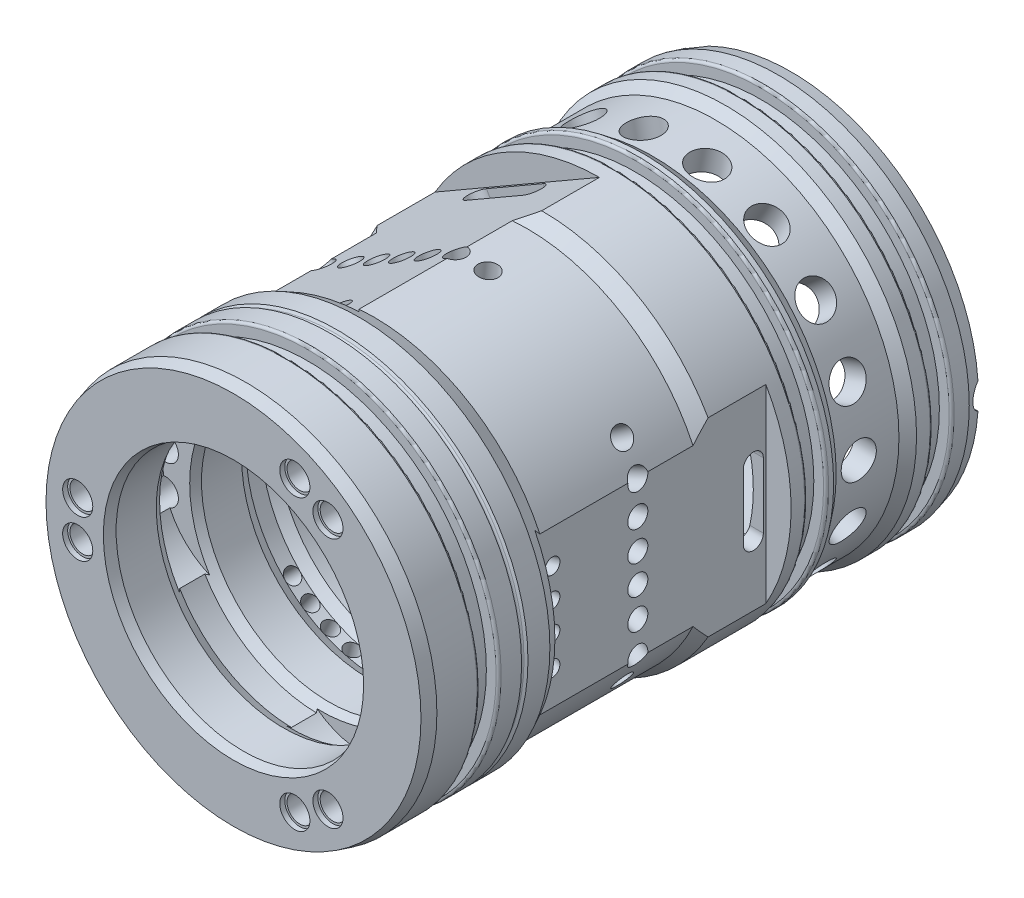
from build123d import *

# Parameters (mm, degrees)
SKETCH2_R          = 3.5
CUT_EXTRUDE1_DEPTH = 124.342390273
CIRPATTERN1_COUNT  = 18
SKETCH3_R          = 3
CUT_EXTRUDE2_DEPTH = 124.342390273
SKETCH4_W          = 10
SKETCH4_H          = 46
CUT_EXTRUDE3_DEPTH = 124.342390363
CIRPATTERN3_COUNT  = 4
CIRPATTERN3_ANGLE  = 30
CIRPATTERN5_COUNT  = 8
CIRPATTERN5_ANGLE  = 70
CUT_EXTRUDE4_DEPTH = 124.342390363
CIRPATTERN2_COUNT  = 3
SKETCH17_R         = 15
CUT_EXTRUDE5_DEPTH = 2.5
SKETCH19_R         = 15
CUT_EXTRUDE6_DEPTH = 3
CIRPATTERN6_COUNT  = 3


# Read off the part's stored shape, not the designer's step: AdvancedHole2
with BuildPart() as part:
    # Sketch1 → Revolve2 (revolve)
    with BuildSketch(Plane(origin=(0, 0, 0), x_dir=(0, 0, -1), z_dir=(1, 0, 0)), mode=Mode.PRIVATE) as revolve2_sk:
        with BuildLine():
            Line((0, 25.910898385), (0, 37.330127019))
            Line((0, 37.330127019), (2.5, 38))
            Line((2.5, 38), (10.5, 38))
            ThreePointArc((10.5, 38), (10.853553391, 37.853553391), (11, 37.5))
            Line((11, 37.5), (11, 35.55))
            Line((11, 35.55), (14.8, 35.55))
            Line((14.8, 35.55), (14.8, 37.5))
            ThreePointArc((14.8, 37.5), (14.946446609, 37.853553391), (15.3, 38))
            Line((15.3, 38), (19.364914704, 38))
            Line((19.364914704, 38), (19.653589838, 37.5))
            ThreePointArc((19.653589838, 37.5), (20, 37.3), (20.346410162, 37.5))
            Line((20.346410162, 37.5), (20.635085296, 38))
            Line((20.635085296, 38), (25, 38))
            Line((25, 38), (28, 36.5))
            Line((28, 36.5), (58.5, 36.5))
            Line((58.5, 36.5), (61.5, 38.028576348))
            Line((61.5, 38.028576348), (75.7, 38.028576348))
            ThreePointArc((75.7, 38.028576348), (76.053553391, 37.882129739), (76.2, 37.528576348))
            Line((76.2, 37.528576348), (76.2, 35.55))
            Line((76.2, 35.55), (80, 35.55))
            Line((80, 35.55), (80, 37.5))
            ThreePointArc((80, 37.5), (80.146446609, 37.853553391), (80.5, 38))
            Line((80.5, 38), (81.5, 38))
            Line((81.5, 38), (83.5, 36.5))
            Line((83.5, 36.5), (96, 36.5))
            Line((96, 36.5), (98, 38.0071081))
            Line((98, 38.0071081), (100.7, 38.0071081))
            ThreePointArc((100.7, 38.0071081), (101.053553391, 37.860661491), (101.2, 37.5071081))
            Line((101.2, 37.5071081), (101.2, 35.55))
            Line((101.2, 35.55), (105, 35.55))
            Line((105, 35.55), (105, 37.5))
            ThreePointArc((105, 37.5), (105.146446609, 37.853553391), (105.5, 38))
            Line((105.5, 38), (108.5, 38))
            Line((108.5, 38), (111, 37.330127019))
            Line((111, 37.330127019), (111, 31.669872981))
            Line((111, 31.669872981), (108.5, 31))
            Line((108.5, 31), (94, 31))
            Line((94, 31), (92, 32))
            Line((92, 32), (84, 32))
            Line((84, 32), (82, 31))
            Line((82, 31), (69, 31))
            Line((69, 31), (68.052094453, 31.167141323))
            ThreePointArc((68.052094453, 31.167141323), (67.701141591, 30.89784572), (68, 30.571698997))
            Line((68, 30.571698997), (68, 28.3))
            ThreePointArc((68, 28.3), (67.912132034, 28.087867966), (67.7, 28))
            Line((67.7, 28), (66.3, 28))
            Line((66.3, 28), (65.552287573, 28.131841875))
            ThreePointArc((65.552287573, 28.131841875), (65.201343141, 27.862642463), (65.5, 27.536399611))
            Line((65.5, 27.536399611), (65.5, 26.43))
            ThreePointArc((65.5, 26.43), (65.412132034, 26.217867966), (65.2, 26.13))
            Line((65.2, 26.13), (59, 26.13))
            Line((59, 26.13), (58, 27))
            Line((58, 27), (54, 27))
            Line((54, 27), (54, 25.68))
            ThreePointArc((54, 25.68), (53.912132034, 25.467867966), (53.7, 25.38))
            Line((53.7, 25.38), (49.8, 25.38))
            ThreePointArc((49.8, 25.38), (49.587867966, 25.467867966), (49.5, 25.68))
            Line((49.5, 25.68), (49.5, 27))
            Line((49.5, 27), (45, 27))
            Line((45, 27), (45, 25.68))
            ThreePointArc((45, 25.68), (44.912132034, 25.467867966), (44.7, 25.38))
            Line((44.7, 25.38), (34, 25.38))
            Line((34, 25.38), (32, 26.5))
            Line((32, 26.5), (29, 26.5))
            Line((29, 26.5), (27, 25.375))
            Line((27, 25.375), (19, 25.375))
            Line((19, 25.375), (17, 26.5))
            Line((17, 26.5), (12, 26.5))
            Line((12, 26.5), (10, 25.375))
            Line((10, 25.375), (2, 25.375))
            Line((2, 25.375), (0, 25.910898385))
        make_face()
    revolve(revolve2_sk.sketch.rotate(Axis((0, 0, 0), (0, 0, -1)), 90), axis=Axis((0, 0, 0), (0, 0, -1)))

    # Sketch2 → Cut-Extrude1 (cut, through all)
    with BuildSketch(Plane(origin=(0, 0, 0), x_dir=(0, 0, -1), z_dir=(1, 0, 0))):
        with Locations(Location((88, 0, 0), (0, 0, 180))):
            Circle(SKETCH2_R)
    cut_extrude1 = extrude(amount=CUT_EXTRUDE1_DEPTH, mode=Mode.SUBTRACT)

    # CirPattern1: Cut-Extrude1 ×18 about axis
    cirpattern1_axis = Axis((0, 0, 0), (0, 0, 1))
    for i in range(1, CIRPATTERN1_COUNT):
        add(cut_extrude1.rotate(cirpattern1_axis, i * 360 / CIRPATTERN1_COUNT), mode=Mode.SUBTRACT)

    # Sketch3 → Cut-Extrude2 (cut, through all)
    with BuildSketch(Plane(origin=(0, 0, 0), x_dir=(0, 0, -1), z_dir=(1, 0, 0))):
        with Locations((112.5, 0)):
            Circle(SKETCH3_R)
    cut_extrude2 = extrude(amount=CUT_EXTRUDE2_DEPTH, mode=Mode.SUBTRACT)

    # Sketch4 → Cut-Extrude3 (cut, symmetric)
    with BuildSketch(Plane(origin=(0, 0, 0), x_dir=(1, 0, 0), z_dir=(0, 1, 0))):
        with Locations((38, 50)):
            Rectangle(SKETCH4_W, SKETCH4_H)
    cut_extrude3 = extrude(amount=CUT_EXTRUDE3_DEPTH, both=True, mode=Mode.SUBTRACT)

    # Sketch5 → Cut-Revolve1 (revolve, cut)
    with BuildSketch(Plane(origin=(0, 0, -30.5), x_dir=(-1, 0, 0), z_dir=(0, 0, -1)), mode=Mode.PRIVATE) as cut_revolve1_sk:
        Polygon((-39.186921609, 10.500103999), (-38.798693042, 11.948992739), (-17.007340538, 6.110017433), (-15.678352617, 4.201001922), align=None)
    cut_revolve1 = revolve(cut_revolve1_sk.sketch.rotate(Axis((15.678352617, 4.201001922, -30.5), (0.9659258262890681, 0.2588190451025214, 0)), 180), axis=Axis((15.678352617, 4.201001922, -30.5), (0.9659258262890681, 0.2588190451025214, 0)), mode=Mode.SUBTRACT)

    # CirPattern3: Cut-Revolve1 ×4 about axis
    cirpattern3_axis = Axis((0, 0, 0), (0, 0, -1))
    for i in range(1, CIRPATTERN3_COUNT):
        add(cut_revolve1.rotate(cirpattern3_axis, i * CIRPATTERN3_ANGLE / (CIRPATTERN3_COUNT - 1)), mode=Mode.SUBTRACT)

    # Sketch6 → Cut-Revolve2 (revolve, cut)
    with BuildSketch(Plane(origin=(0, 0, -47.5), x_dir=(-1, 0, 0), z_dir=(0, 0, -1)), mode=Mode.PRIVATE) as cut_revolve2_sk:
        Polygon((-35.190388348, 24.640575194), (-34.043235476, 26.278879283), (-14.711587241, 12.742713463), (-14.711587241, 10.301164285), align=None)
    cut_revolve2 = revolve(cut_revolve2_sk.sketch.rotate(Axis((14.711587241, 10.301164285, -47.5), (0.819152044288991, 0.5735764363510472, 0)), 180), axis=Axis((14.711587241, 10.301164285, -47.5), (0.819152044288991, 0.5735764363510472, 0)), mode=Mode.SUBTRACT)

    # CirPattern5: Cut-Revolve2 ×8 about axis
    cirpattern5_axis = Axis((0, 0, 0), (0, 0, -1))
    for i in range(1, CIRPATTERN5_COUNT):
        add(cut_revolve2.rotate(cirpattern5_axis, i * CIRPATTERN5_ANGLE / (CIRPATTERN5_COUNT - 1)), mode=Mode.SUBTRACT)

    # Sketch7 → Cut-Extrude4 (cut, through all)
    with BuildSketch(Plane(origin=(0, 0, 0), x_dir=(0, 0, -1), z_dir=(1, 0, 0))):
        with BuildLine():
            Line((72.5, -6.5), (72.5, 6.5))
            ThreePointArc((72.5, 6.5), (70.5, 8.5), (68.5, 6.5))
            Line((68.5, 6.5), (68.5, -6.5))
            ThreePointArc((68.5, -6.5), (70.5, -8.5), (72.5, -6.5))
        make_face()
    cut_extrude4 = extrude(amount=CUT_EXTRUDE4_DEPTH, mode=Mode.SUBTRACT)

    # CirPattern2: Cut-Extrude2, Cut-Extrude3, Cut-Revolve1, Cut-Revolve2, Cut-Extrude4 ×3 about axis
    cirpattern2_axis = Axis((0, 0, 0), (0, 0, 1))
    add([cut_extrude2.rotate(cirpattern2_axis, i * 360 / CIRPATTERN2_COUNT) for i in range(1, CIRPATTERN2_COUNT)], mode=Mode.SUBTRACT)
    add([cut_extrude3.rotate(cirpattern2_axis, i * 360 / CIRPATTERN2_COUNT) for i in range(1, CIRPATTERN2_COUNT)], mode=Mode.SUBTRACT)
    add([cut_revolve1.rotate(cirpattern2_axis, i * 360 / CIRPATTERN2_COUNT) for i in range(1, CIRPATTERN2_COUNT)], mode=Mode.SUBTRACT)
    add([cut_revolve2.rotate(cirpattern2_axis, i * 360 / CIRPATTERN2_COUNT) for i in range(1, CIRPATTERN2_COUNT)], mode=Mode.SUBTRACT)
    add([cut_extrude4.rotate(cirpattern2_axis, i * 360 / CIRPATTERN2_COUNT) for i in range(1, CIRPATTERN2_COUNT)], mode=Mode.SUBTRACT)

    # CirPattern2 copy 1 sketch → CirPattern2 copy 1 (revolve, cut)
    with BuildSketch(Plane(origin=(0, 0, -30.5), x_dir=(0.3420201433256681, -0.9396926207859086, 0), z_dir=(0, 0, -1))):
        Polygon((-39.186921609, 10.500103999), (-38.798693042, 11.948992739), (-17.007340538, 6.110017433), (-15.678352617, 4.201001922), align=None)
    revolve(axis=Axis((-9.309962916, 13.296004981, -30.5), (-0.573576436351046, 0.8191520442889918, 0)), mode=Mode.SUBTRACT)

    # CirPattern2 copy 2 sketch → CirPattern2 copy 2 (revolve, cut)
    with BuildSketch(Plane(origin=(0, 0, -30.5), x_dir=(0.64278760968654, 0.7660444431189775, 0), z_dir=(0, 0, -1))):
        Polygon((-39.186921609, 10.500103999), (-38.798693042, 11.948992739), (-17.007340538, 6.110017433), (-15.678352617, 4.201001922), align=None)
    revolve(axis=Axis((-6.859696624, -14.710666884, -30.5), (-0.4226182617406996, -0.9063077870366498, 0)), mode=Mode.SUBTRACT)

    # CirPattern2 copy 3 sketch → CirPattern2 copy 3 (revolve, cut)
    with BuildSketch(Plane(origin=(0, 0, -30.5), x_dir=(0.1736481776669293, -0.9848077530122081, 0), z_dir=(0, 0, -1))):
        Polygon((-39.186921609, 10.500103999), (-38.798693042, 11.948992739), (-17.007340538, 6.110017433), (-15.678352617, 4.201001922), align=None)
    revolve(axis=Axis((-6.859696624, 14.710666884, -30.5), (-0.42261826174069905, 0.9063077870366499, 0)), mode=Mode.SUBTRACT)

    # CirPattern2 copy 4 sketch → CirPattern2 copy 4 (revolve, cut)
    with BuildSketch(Plane(origin=(0, 0, -30.5), x_dir=(0.7660444431189789, 0.6427876096865383, 0), z_dir=(0, 0, -1))):
        Polygon((-39.186921609, 10.500103999), (-38.798693042, 11.948992739), (-17.007340538, 6.110017433), (-15.678352617, 4.201001922), align=None)
    revolve(axis=Axis((-9.309962916, -13.296004981, -30.5), (-0.5735764363510466, -0.8191520442889914, 0)), mode=Mode.SUBTRACT)

    # CirPattern2 copy 5 sketch → CirPattern2 copy 5 (revolve, cut)
    with BuildSketch(Plane(origin=(0, 0, -30.5), x_dir=(0, -1, 0), z_dir=(0, 0, -1))):
        Polygon((-39.186921609, 10.500103999), (-38.798693042, 11.948992739), (-17.007340538, 6.110017433), (-15.678352617, 4.201001922), align=None)
    revolve(axis=Axis((-4.201001922, 15.678352617, -30.5), (-0.25881904510252, 0.9659258262890684, 0)), mode=Mode.SUBTRACT)

    # CirPattern2 copy 6 sketch → CirPattern2 copy 6 (revolve, cut)
    with BuildSketch(Plane(origin=(0, 0, -30.5), x_dir=(0.8660254037844395, 0.49999999999999845, 0), z_dir=(0, 0, -1))):
        Polygon((-39.186921609, 10.500103999), (-38.798693042, 11.948992739), (-17.007340538, 6.110017433), (-15.678352617, 4.201001922), align=None)
    revolve(axis=Axis((-11.477350695, -11.477350695, -30.5), (-0.7071067811865481, -0.7071067811865467, 0)), mode=Mode.SUBTRACT)

    # CirPattern2 copy 7 sketch → CirPattern2 copy 7 (revolve, cut)
    with BuildSketch(Plane(origin=(0, 0, -47.5), x_dir=(0.3420201433256681, -0.9396926207859086, 0), z_dir=(0, 0, -1))):
        Polygon((-35.190388348, 24.640575194), (-34.043235476, 26.278879283), (-14.711587241, 12.742713463), (-14.711587241, 10.301164285), align=None)
    revolve(axis=Axis((-14.711587241, 10.301164285, -47.5), (-0.8191520442889921, 0.5735764363510456, 0)), mode=Mode.SUBTRACT)

    # CirPattern2 copy 8 sketch → CirPattern2 copy 8 (revolve, cut)
    with BuildSketch(Plane(origin=(0, 0, -47.5), x_dir=(0.64278760968654, 0.7660444431189775, 0), z_dir=(0, 0, -1))):
        Polygon((-35.190388348, 24.640575194), (-34.043235476, 26.278879283), (-14.711587241, 12.742713463), (-14.711587241, 10.301164285), align=None)
    revolve(axis=Axis((-1.565276339, -17.891190423, -47.5), (-0.08715574274765775, -0.9961946980917455, 0)), mode=Mode.SUBTRACT)

    # CirPattern2 copy 9 sketch → CirPattern2 copy 9 (revolve, cut)
    with BuildSketch(Plane(origin=(0, 0, -47.5), x_dir=(0.1736481776669293, -0.9848077530122081, 0), z_dir=(0, 0, -1))):
        Polygon((-35.190388348, 24.640575194), (-34.043235476, 26.278879283), (-14.711587241, 12.742713463), (-14.711587241, 10.301164285), align=None)
    revolve(axis=Axis((-12.699306768, 12.699306768, -47.5), (-0.7071067811865477, 0.7071067811865472, 0)), mode=Mode.SUBTRACT)

    # CirPattern2 copy 10 sketch → CirPattern2 copy 10 (revolve, cut)
    with BuildSketch(Plane(origin=(0, 0, -47.5), x_dir=(0.7660444431189789, 0.6427876096865383, 0), z_dir=(0, 0, -1))):
        Polygon((-35.190388348, 24.640575194), (-34.043235476, 26.278879283), (-14.711587241, 12.742713463), (-14.711587241, 10.301164285), align=None)
    revolve(axis=Axis((-4.648268888, -17.347575656, -47.5), (-0.2588190451025208, -0.9659258262890682, 0)), mode=Mode.SUBTRACT)

    # CirPattern2 copy 11 sketch → CirPattern2 copy 11 (revolve, cut)
    with BuildSketch(Plane(origin=(0, 0, -47.5), x_dir=(0, -1, 0), z_dir=(0, 0, -1))):
        Polygon((-35.190388348, 24.640575194), (-34.043235476, 26.278879283), (-14.711587241, 12.742713463), (-14.711587241, 10.301164285), align=None)
    revolve(axis=Axis((-10.301164285, 14.711587241, -47.5), (-0.5735764363510459, 0.8191520442889918, 0)), mode=Mode.SUBTRACT)

    # CirPattern2 copy 12 sketch → CirPattern2 copy 12 (revolve, cut)
    with BuildSketch(Plane(origin=(0, 0, -47.5), x_dir=(0.8660254037844395, 0.49999999999999845, 0), z_dir=(0, 0, -1))):
        Polygon((-35.190388348, 24.640575194), (-34.043235476, 26.278879283), (-14.711587241, 12.742713463), (-14.711587241, 10.301164285), align=None)
    revolve(axis=Axis((-7.590026138, -16.27686358, -47.5), (-0.42261826174069983, -0.9063077870366497, 0)), mode=Mode.SUBTRACT)

    # CirPattern2 copy 13 sketch → CirPattern2 copy 13 (revolve, cut)
    with BuildSketch(Plane(origin=(0, 0, -47.5), x_dir=(-0.17364817766693214, -0.9848077530122077, 0), z_dir=(0, 0, -1))):
        Polygon((-35.190388348, 24.640575194), (-34.043235476, 26.278879283), (-14.711587241, 12.742713463), (-14.711587241, 10.301164285), align=None)
    revolve(axis=Axis((-7.590026138, 16.27686358, -47.5), (-0.422618261740699, 0.90630778703665, 0)), mode=Mode.SUBTRACT)

    # CirPattern2 copy 14 sketch → CirPattern2 copy 14 (revolve, cut)
    with BuildSketch(Plane(origin=(0, 0, -47.5), x_dir=(0.9396926207859091, 0.3420201433256667, 0), z_dir=(0, 0, -1))):
        Polygon((-35.190388348, 24.640575194), (-34.043235476, 26.278879283), (-14.711587241, 12.742713463), (-14.711587241, 10.301164285), align=None)
    revolve(axis=Axis((-10.301164285, -14.711587241, -47.5), (-0.5735764363510467, -0.8191520442889912, 0)), mode=Mode.SUBTRACT)

    # CirPattern2 copy 15 sketch → CirPattern2 copy 15 (revolve, cut)
    with BuildSketch(Plane(origin=(0, 0, -47.5), x_dir=(-0.3420201433256709, -0.9396926207859077, 0), z_dir=(0, 0, -1))):
        Polygon((-35.190388348, 24.640575194), (-34.043235476, 26.278879283), (-14.711587241, 12.742713463), (-14.711587241, 10.301164285), align=None)
    revolve(axis=Axis((-4.648268888, 17.347575656, -47.5), (-0.25881904510251985, 0.9659258262890686, 0)), mode=Mode.SUBTRACT)

    # CirPattern2 copy 16 sketch → CirPattern2 copy 16 (revolve, cut)
    with BuildSketch(Plane(origin=(0, 0, -47.5), x_dir=(0.9848077530122085, 0.17364817766692792, 0), z_dir=(0, 0, -1))):
        Polygon((-35.190388348, 24.640575194), (-34.043235476, 26.278879283), (-14.711587241, 12.742713463), (-14.711587241, 10.301164285), align=None)
    revolve(axis=Axis((-12.699306768, -12.699306768, -47.5), (-0.7071067811865483, -0.7071067811865468, 0)), mode=Mode.SUBTRACT)

    # CirPattern2 copy 17 sketch → CirPattern2 copy 17 (revolve, cut)
    with BuildSketch(Plane(origin=(0, 0, -47.5), x_dir=(-0.5000000000000023, -0.8660254037844373, 0), z_dir=(0, 0, -1))):
        Polygon((-35.190388348, 24.640575194), (-34.043235476, 26.278879283), (-14.711587241, 12.742713463), (-14.711587241, 10.301164285), align=None)
    revolve(axis=Axis((-1.565276339, 17.891190423, -47.5), (-0.0871557427476568, 0.9961946980917455, 0)), mode=Mode.SUBTRACT)

    # CirPattern2 copy 18 sketch → CirPattern2 copy 18 (revolve, cut)
    with BuildSketch(Plane(origin=(0, 0, -47.5), x_dir=(1, 0, 0), z_dir=(0, 0, -1))):
        Polygon((-35.190388348, 24.640575194), (-34.043235476, 26.278879283), (-14.711587241, 12.742713463), (-14.711587241, 10.301164285), align=None)
    revolve(axis=Axis((-14.711587241, -10.301164285, -47.5), (-0.8191520442889928, -0.5735764363510446, 0)), mode=Mode.SUBTRACT)

    # CirPattern2 copy 19 sketch → CirPattern2 copy 19 (revolve, cut)
    with BuildSketch(Plane(origin=(0, 0, -47.5), x_dir=(-0.6427876096865416, -0.766044443118976, 0), z_dir=(0, 0, -1))):
        Polygon((-35.190388348, 24.640575194), (-34.043235476, 26.278879283), (-14.711587241, 12.742713463), (-14.711587241, 10.301164285), align=None)
    revolve(axis=Axis((1.565276339, 17.891190423, -47.5), (0.08715574274765991, 0.9961946980917453, 0)), mode=Mode.SUBTRACT)

    # CirPattern2 copy 20 sketch → CirPattern2 copy 20 (revolve, cut)
    with BuildSketch(Plane(origin=(0, 0, -47.5), x_dir=(0.9848077530122075, -0.17364817766693363, 0), z_dir=(0, 0, -1))):
        Polygon((-35.190388348, 24.640575194), (-34.043235476, 26.278879283), (-14.711587241, 12.742713463), (-14.711587241, 10.301164285), align=None)
    revolve(axis=Axis((-16.27686358, -7.590026138, -47.5), (-0.9063077870366508, -0.42261826174069755, 0)), mode=Mode.SUBTRACT)

    # AdvancedHole2 outline → AdvancedHole2 (revolve, cut)
    with BuildSketch(Plane(origin=(12.210347765, -28.76577667, 0), x_dir=(1, 0, 0), z_dir=(0, -1, 0))):
        Polygon((2.55, -1), (3, -1), (3, 0), (0, 0), (0, -62.532194579), (2.55, -61), align=None)
    revolve(axis=Axis((12.210347765, -28.76577667, 0), (0, 0, 1)), mode=Mode.SUBTRACT)

    # AdvancedHole2 2 outline → AdvancedHole2 2 (revolve, cut)
    with BuildSketch(Plane(origin=(18.806719474, -24.957359689, 0), x_dir=(1, 0, 0), z_dir=(0, -1, 0))):
        Polygon((3, 0), (0, 0), (0, -62.532194579), (2.55, -61), (2.55, -1), (3, -1), align=None)
    revolve(axis=Axis((18.806719474, -24.957359689, 0), (0, 0, 1)), mode=Mode.SUBTRACT)

    # AdvancedHole2 3 outline → AdvancedHole2 3 (revolve, cut)
    with BuildSketch(Plane(origin=(18.806719474, 24.957359689, 0), x_dir=(1, 0, 0), z_dir=(0, -1, 0))):
        Polygon((3, 0), (0, 0), (0, -62.532194579), (2.55, -61), (2.55, -1), (3, -1), align=None)
    revolve(axis=Axis((18.806719474, 24.957359689, 0), (0, 0, 1)), mode=Mode.SUBTRACT)

    # AdvancedHole2 4 outline → AdvancedHole2 4 (revolve, cut)
    with BuildSketch(Plane(origin=(12.210347765, 28.76577667, 0), x_dir=(1, 0, 0), z_dir=(0, -1, 0))):
        Polygon((3, 0), (0, 0), (0, -62.532194579), (2.55, -61), (2.55, -1), (3, -1), align=None)
    revolve(axis=Axis((12.210347765, 28.76577667, 0), (0, 0, 1)), mode=Mode.SUBTRACT)

    # AdvancedHole2 5 outline → AdvancedHole2 5 (revolve, cut)
    with BuildSketch(Plane(origin=(-31.017067239, 3.808416981, 0), x_dir=(1, 0, 0), z_dir=(0, -1, 0))):
        Polygon((3, 0), (0, 0), (0, -62.532194579), (2.55, -61), (2.55, -1), (3, -1), align=None)
    revolve(axis=Axis((-31.017067239, 3.808416981, 0), (0, 0, 1)), mode=Mode.SUBTRACT)

    # AdvancedHole2 6 outline → AdvancedHole2 6 (revolve, cut)
    with BuildSketch(Plane(origin=(-31.017067239, -3.808416981, 0), x_dir=(1, 0, 0), z_dir=(0, -1, 0))):
        Polygon((3, 0), (0, 0), (0, -62.532194579), (2.55, -61), (2.55, -1), (3, -1), align=None)
    revolve(axis=Axis((-31.017067239, -3.808416981, 0), (0, 0, 1)), mode=Mode.SUBTRACT)

    # Sketch17 → Cut-Extrude5 (cut, symmetric)
    with BuildSketch(Plane(origin=(0, 0, -56.5), x_dir=(-1, 0, 0), z_dir=(0, 0, -1))):
        with Locations((16.5, 0)):
            Circle(SKETCH17_R)
    cut_extrude5 = extrude(amount=CUT_EXTRUDE5_DEPTH, both=True, mode=Mode.SUBTRACT)

    # Sketch19 → Cut-Extrude6 (cut, symmetric)
    with BuildSketch(Plane.XY.offset(-14.5)):
        with Locations((-16.5, 0)):
            Circle(SKETCH19_R)
    cut_extrude6 = extrude(amount=CUT_EXTRUDE6_DEPTH, both=True, mode=Mode.SUBTRACT)

    # CirPattern6: Cut-Extrude5, Cut-Extrude6 ×3 about axis
    cirpattern6_axis = Axis((0, 0, 0), (0, 0, 1))
    add([cut_extrude5.rotate(cirpattern6_axis, i * 360 / CIRPATTERN6_COUNT) for i in range(1, CIRPATTERN6_COUNT)], mode=Mode.SUBTRACT)
    add([cut_extrude6.rotate(cirpattern6_axis, i * 360 / CIRPATTERN6_COUNT) for i in range(1, CIRPATTERN6_COUNT)], mode=Mode.SUBTRACT)


solid = part.part
